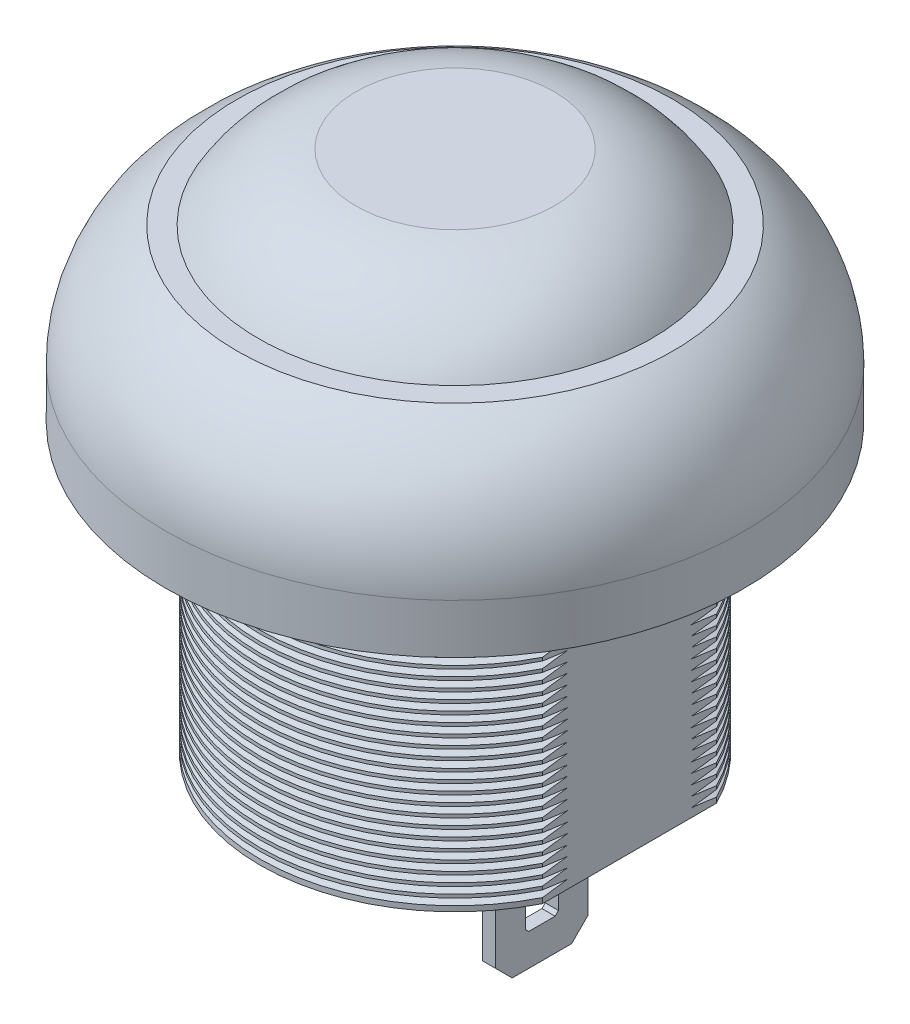
from build123d import *

# Parameters (mm, degrees)
SKETCH1_R                = 8.75
BOSS_EXTRUDE1_DEPTH      = 1.5
SKETCH7_R                = 6.61
BOSS_EXTRUDE2_DEPTH      = 1.12
SKETCH8_R                = 5.9
BOSS_EXTRUDE3_DEPTH      = 7.56
SKETCH9_R                = 4.34
BOSS_EXTRUDE4_DEPTH      = 0.7
BOSS_EXTRUDE5_DEPTH      = 1.4
BOSS_EXTRUDE5_DEPTH_BACK = 1.4
SKETCH10_W               = 0.4
SKETCH10_H               = 3.44
CHAMFER1_SIZE            = 0.5
CUT_EXTRUDE1_DEPTH       = 20.246280265
CUT_EXTRUDE2_START       = -7.56
CUT_EXTRUDE2_DEPTH       = 7.56
CUT_EXTRUDE3_START       = -1.12
CUT_EXTRUDE3_DEPTH       = 1.12


with BuildPart() as part:
    # Sketch1 → Boss-Extrude1 (new body)
    with BuildSketch(Plane(origin=(0, 0, 0), x_dir=(1, 0, 0), z_dir=(0, 1, 0))):
        with Locations(Location((0, 0, 0), (0, 0, 270))):
            Circle(SKETCH1_R)
    extrude(amount=BOSS_EXTRUDE1_DEPTH)

    # Sketch3 → Revolve1 (revolve)
    with BuildSketch(Plane.XY, mode=Mode.PRIVATE) as revolve1_sk:
        with BuildLine():
            Line((-8.75, 1.5), (0, 1.5))
            Line((0, 1.5), (0, 5.15))
            Line((0, 5.15), (-6.6, 5.15))
            ThreePointArc((-6.6, 5.15), (-8.172549254, 3.618076958), (-8.75, 1.5))
        make_face()
    revolve(revolve1_sk.sketch.rotate(Axis((0, 1.5, 0), (0, 1, 0)), 270), axis=Axis((0, 1.5, 0), (0, 1, 0)))

    # Sketch6 → Revolve2 (revolve)
    with BuildSketch(Plane.XY, mode=Mode.PRIVATE) as revolve2_sk:
        with BuildLine():
            Line((-3, 7.15), (0, 7.15))
            Line((0, 7.15), (0, 5.15))
            Line((0, 5.15), (-5.95, 5.15))
            ThreePointArc((-5.95, 5.15), (-4.699241766, 6.480756605), (-3, 7.15))
        make_face()
    revolve(revolve2_sk.sketch.rotate(Axis((0, 5.15, 0), (0, 1, 0)), 270), axis=Axis((0, 5.15, 0), (0, 1, 0)))

    # Sketch7 → Boss-Extrude2 (add)
    with BuildSketch(Plane.XZ):
        with Locations(Location((0, 0, 0), (0, 0, 90))):
            Circle(SKETCH7_R)
    extrude(amount=BOSS_EXTRUDE2_DEPTH)

    # Sketch8 → Boss-Extrude3 (add)
    with BuildSketch(Plane.XZ.offset(1.12)):
        with Locations(Location((0, 0, 0), (0, 0, 270))):
            Circle(SKETCH8_R)
    extrude(amount=BOSS_EXTRUDE3_DEPTH)

    # Sketch9 → Boss-Extrude4 (add)
    with BuildSketch(Plane.XZ.offset(8.68)):
        with Locations(Location((0, 0, 0), (0, 0, 270))):
            Circle(SKETCH9_R)
    extrude(amount=BOSS_EXTRUDE4_DEPTH)

    # Sketch10 → Boss-Extrude5 (add, two sides: drawn at the far end of the back side and taken through both)
    with BuildSketch(Plane.XY.offset(-BOSS_EXTRUDE5_DEPTH_BACK)):
        with Locations((-2.43, -11.1)):
            Rectangle(SKETCH10_W, SKETCH10_H)
        with Locations((2.43, -11.1)):
            Rectangle(SKETCH10_W, SKETCH10_H)
    extrude(amount=BOSS_EXTRUDE5_DEPTH + BOSS_EXTRUDE5_DEPTH_BACK)

    # Chamfer1
    chamfer1_edges = [part.edges().sort_by_distance(p)[0] for p in [
        (-2.43, -12.82, -1.4),
        (-2.43, -12.82, 1.4),
        (2.43, -12.82, -1.4),
        (2.43, -12.82, 1.4),
    ]]
    chamfer(chamfer1_edges, length=CHAMFER1_SIZE)

    # Sketch11 → Cut-Extrude1 (cut, through all)
    with BuildSketch(Plane(origin=(2.63, 0, 0), x_dir=(0, 0, -1), z_dir=(1, 0, 0))):
        Polygon((0.5, -10.45), (0.4, -10.35), (-0.4, -10.35), (-0.5, -10.45), (-0.5, -11.75), (-0.4, -11.85), (0.4, -11.85), (0.5, -11.75), align=None)
    extrude(amount=-CUT_EXTRUDE1_DEPTH, mode=Mode.SUBTRACT)

    # Sketch12 → Cut-Extrude2 (cut)
    with BuildSketch(Plane.XZ.offset(8.68).offset(CUT_EXTRUDE2_START)):
        with BuildLine():
            Line((5.28, 2.632793194), (5.28, -2.632793194))
            ThreePointArc((5.28, -2.632793194), (5.9, 0), (5.28, 2.632793194))
        make_face()
        with BuildLine():
            Line((-5.28, 2.632793194), (-5.28, -2.632793194))
            ThreePointArc((-5.28, -2.632793194), (-5.9, 0), (-5.28, 2.632793194))
        make_face()
    extrude(amount=CUT_EXTRUDE2_DEPTH, mode=Mode.SUBTRACT)

    # Sketch13 → Cut-Extrude3 (cut)
    with BuildSketch(Plane.XZ.offset(1.12).offset(CUT_EXTRUDE3_START)):
        with BuildLine():
            Line((-2.980285221, 5.9), (2.980285221, 5.9))
            ThreePointArc((2.980285221, 5.9), (0, 6.61), (-2.980285221, 5.9))
        make_face()
    extrude(amount=CUT_EXTRUDE3_DEPTH, mode=Mode.SUBTRACT)

    # Sketch14 → Cut-Revolve1 (revolve, cut)
    with BuildSketch(Plane(origin=(0, 0, 0), x_dir=(0, 0, -1), z_dir=(1, 0, 0)), mode=Mode.PRIVATE) as cut_revolve1_sk:
        Polygon((-5.9, -1.12), (-5.6, -1.22), (-5.9, -1.32), align=None)
        Polygon((-5.6, -1.52), (-5.9, -1.62), (-5.9, -1.42), align=None)
        Polygon((-5.6, -1.82), (-5.9, -1.92), (-5.9, -1.72), align=None)
        Polygon((-5.6, -2.12), (-5.9, -2.22), (-5.9, -2.02), align=None)
        Polygon((-5.6, -2.42), (-5.9, -2.52), (-5.9, -2.32), align=None)
        Polygon((-5.6, -2.72), (-5.9, -2.82), (-5.9, -2.62), align=None)
        Polygon((-5.6, -3.02), (-5.9, -3.12), (-5.9, -2.92), align=None)
        Polygon((-5.6, -3.32), (-5.9, -3.42), (-5.9, -3.22), align=None)
        Polygon((-5.6, -3.62), (-5.9, -3.72), (-5.9, -3.52), align=None)
        Polygon((-5.6, -3.92), (-5.9, -4.02), (-5.9, -3.82), align=None)
        Polygon((-5.6, -4.22), (-5.9, -4.32), (-5.9, -4.12), align=None)
        Polygon((-5.6, -4.52), (-5.9, -4.62), (-5.9, -4.42), align=None)
        Polygon((-5.6, -4.82), (-5.9, -4.92), (-5.9, -4.72), align=None)
        Polygon((-5.6, -5.12), (-5.9, -5.22), (-5.9, -5.02), align=None)
        Polygon((-5.6, -5.42), (-5.9, -5.52), (-5.9, -5.32), align=None)
        Polygon((-5.6, -5.72), (-5.9, -5.82), (-5.9, -5.62), align=None)
        Polygon((-5.6, -6.02), (-5.9, -6.12), (-5.9, -5.92), align=None)
        Polygon((-5.6, -6.32), (-5.9, -6.42), (-5.9, -6.22), align=None)
        Polygon((-5.6, -6.62), (-5.9, -6.72), (-5.9, -6.52), align=None)
        Polygon((-5.6, -6.92), (-5.9, -7.02), (-5.9, -6.82), align=None)
        Polygon((-5.6, -7.22), (-5.9, -7.32), (-5.9, -7.12), align=None)
        Polygon((-5.6, -7.52), (-5.9, -7.62), (-5.9, -7.42), align=None)
        Polygon((-5.6, -7.82), (-5.9, -7.92), (-5.9, -7.72), align=None)
        Polygon((-5.6, -8.12), (-5.9, -8.22), (-5.9, -8.02), align=None)
        Polygon((-5.6, -8.42), (-5.9, -8.52), (-5.9, -8.32), align=None)
    revolve(cut_revolve1_sk.sketch.rotate(Axis((0, 0, 0), (0, -1, 0)), 180), axis=Axis((0, 0, 0), (0, -1, 0)), mode=Mode.SUBTRACT)


solid = part.part
